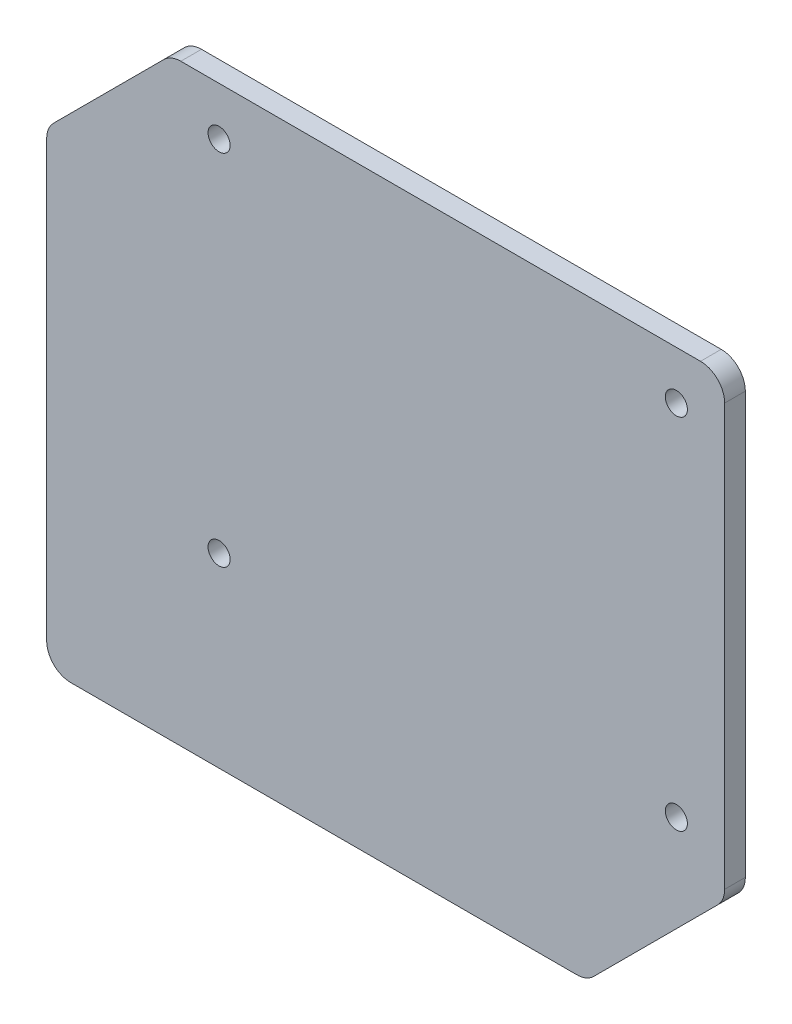
from build123d import *

# Parameters (mm, degrees)
BOSS_EXTRUDE1_DEPTH        = 3
FILLET1_R                  = 3.5
F_3_2_3_2_DIAMETER_HOLE1_D = 3.2


with BuildPart() as part:
    # Sketch1 → Boss-Extrude1 (new body)
    with BuildSketch(Plane.XY):
        Polygon((60.3, -20), (80.3, 0), (80.3, 66), (0, 66), (-18, 48), (-18, -20), align=None)
    extrude(amount=BOSS_EXTRUDE1_DEPTH)

    # Fillet1
    fillet1_edges = [part.edges().sort_by_distance(p)[0] for p in [
        (80.3, 0, 1.5),
        (60.3, -20, 1.5),
        (-18, -20, 1.5),
        (-18, 48, 1.5),
        (80.3, 66, 1.5),
        (0, 66, 1.5),
    ]]
    fillet(fillet1_edges, radius=FILLET1_R)

    # Ø3.2 (3.2) Diameter Hole1 (through all)
    with Locations(Plane.XY.offset(3)):
        with Locations((7, 59), (73.3, 59), (73.3, 7), (7, 7)):
            Hole(F_3_2_3_2_DIAMETER_HOLE1_D / 2)


solid = part.part
